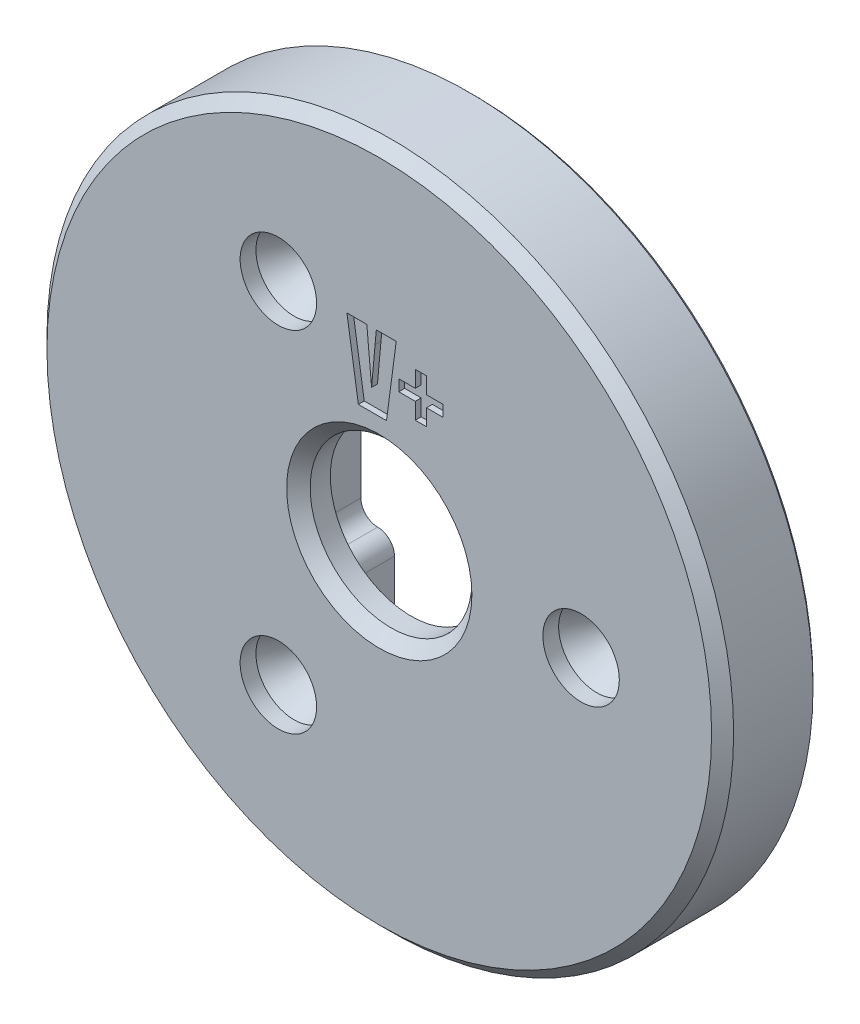
from build123d import *

# Parameters (mm, degrees)
SKETCH_3_R          = 23.35
EXTRUDE_3_DEPTH     = 6.4
SKETCH_2_R          = 21.8
CUT_EXTRUDE_1_DEPTH = 1.63
CUT_EXTRUDE_START   = 1.63
CUT_EXTRUDE_2_DEPTH = 2.6
SKETCH_5_R          = 1.35000002
SKETCH_5_R_2        = 1.35
CUT_EXTRUDE_3_DEPTH = 4.77
CUT_EXTRUDE_START_2 = 4.23
SKETCH_5_3_R        = 5.5
CUT_EXTRUDE_4_DEPTH = 2.17
CHAMFER_1_SIZE      = 0.75
CUT_EXTRUDE_START_3 = 6.4
SKETCH_6_R          = 2.6
CUT_EXTRUDE_5_DEPTH = 1
CHAMFER_2_SIZE      = 1.29
CHAMFER_2_SIZE_2    = 2.385
CHAMFER_3_SIZE      = 0.25
CHAMFER_4_SIZE      = 0.8
CUT_EXTRUDE_7_DEPTH = 0.4
CUT_EXTRUDE_8_DEPTH = 1.5


with BuildPart() as part:
    # 草图3 → 凸台-拉伸3 (new body)
    with BuildSketch(Plane.XY):
        with Locations((100.00000066, 100.00000066)):
            Circle(SKETCH_3_R)
    extrude(amount=EXTRUDE_3_DEPTH)

    # 草图2 → 切除-拉伸1 (cut)
    with BuildSketch(Plane.XY):
        with Locations((100.00000066, 100.00000066)):
            Circle(SKETCH_2_R)
    extrude(amount=CUT_EXTRUDE_1_DEPTH, mode=Mode.SUBTRACT)

    # 草图4 → 切除-拉伸2 (cut)
    with BuildSketch(Plane.XY.offset(CUT_EXTRUDE_START)):
        with BuildLine():
            Line((98.171, 114.173), (98.171, 115.57))
            ThreePointArc((98.171, 115.57), (98.282592316, 115.839407684), (98.552, 115.951))
            Line((98.552, 115.951), (102.87, 115.951))
            ThreePointArc((102.87, 115.951), (103.139407684, 115.839407684), (103.251, 115.57))
            Line((103.251, 115.57), (103.251, 114.808))
            ThreePointArc((103.251, 114.808), (103.362592316, 114.538592316), (103.632, 114.427))
            Line((103.632, 114.427), (109.728, 114.427))
            ThreePointArc((109.728, 114.427), (110.44642049, 114.12942049), (110.744, 113.411))
            Line((110.744, 113.411), (110.744, 110.363))
            ThreePointArc((110.744, 110.363), (110.892789755, 110.003789755), (111.252, 109.855))
            Line((111.252, 109.855), (115.951, 109.855))
            ThreePointArc((115.951, 109.855), (116.489815367, 109.631815367), (116.713, 109.093))
            Line((116.713, 109.093), (116.713, 104.521))
            ThreePointArc((116.713, 104.521), (117.01057951, 103.80257951), (117.729, 103.505))
            ThreePointArc((117.729, 103.505), (118.088210245, 103.356210245), (118.237, 102.997))
            Line((118.237, 102.997), (118.237, 102.362))
            ThreePointArc((118.237, 102.362), (118.162605122, 102.182394878), (117.983, 102.108))
            Line((117.983, 102.108), (116.586, 102.108))
            ThreePointArc((116.586, 102.108), (116.226789755, 102.256789755), (116.078, 102.616))
            ThreePointArc((116.078, 102.616), (115.892012806, 103.065012806), (115.443, 103.251))
            Line((115.443, 103.251), (106.426, 103.251))
            ThreePointArc((106.426, 103.251), (105.976987194, 103.065012806), (105.791, 102.616))
            Line((105.791, 102.616), (105.791, 95.377))
            ThreePointArc((105.791, 95.377), (105.939789755, 95.017789755), (106.299, 94.869))
            Line((106.299, 94.869), (115.57, 94.869))
            ThreePointArc((115.57, 94.869), (115.749605122, 94.794605122), (115.824, 94.615))
            Line((115.824, 94.615), (115.824, 92.202))
            ThreePointArc((115.824, 92.202), (115.638012806, 91.752987194), (115.189, 91.567))
            Line((115.189, 91.567), (115.062, 91.567))
            ThreePointArc((115.062, 91.567), (114.702789755, 91.418210245), (114.554, 91.059))
            Line((114.554, 91.059), (114.554, 89.662))
            ThreePointArc((114.554, 89.662), (114.405210245, 89.302789755), (114.046, 89.154))
            Line((114.046, 89.154), (111.887, 89.154))
            ThreePointArc((111.887, 89.154), (111.527789755, 89.005210245), (111.379, 88.646))
            Line((111.379, 88.646), (111.379, 87.884))
            ThreePointArc((111.379, 87.884), (111.230210245, 87.524789755), (110.871, 87.376))
            Line((110.871, 87.376), (109.855, 87.376))
            ThreePointArc((109.855, 87.376), (109.495789755, 87.227210245), (109.347, 86.868))
            Line((109.347, 86.868), (109.347, 85.344))
            ThreePointArc((109.347, 85.344), (109.161012806, 84.894987194), (108.712, 84.709))
            Line((108.712, 84.709), (107.188, 84.709))
            ThreePointArc((107.188, 84.709), (107.008394878, 84.634605122), (106.934, 84.455))
            ThreePointArc((106.934, 84.455), (106.896802561, 84.365197439), (106.807, 84.328))
            Line((106.807, 84.328), (103.759, 84.328))
            ThreePointArc((103.759, 84.328), (103.130382072, 84.067617928), (102.87, 83.439))
            ThreePointArc((102.87, 83.439), (102.758407684, 83.169592316), (102.489, 83.058))
            Line((102.489, 83.058), (96.901, 83.058))
            ThreePointArc((96.901, 83.058), (96.451987194, 83.243987194), (96.266, 83.693))
            Line((96.266, 83.693), (96.266, 94.869))
            ThreePointArc((96.266, 94.869), (95.931223051, 95.677223051), (95.123, 96.012))
            ThreePointArc((95.123, 96.012), (94.314776949, 96.346776949), (93.98, 97.155))
            Line((93.98, 97.155), (93.98, 103.632))
            ThreePointArc((93.98, 103.632), (94.351974388, 104.530025612), (95.25, 104.902))
            ThreePointArc((95.25, 104.902), (96.058223051, 105.236776949), (96.393, 106.045))
            Line((96.393, 106.045), (96.393, 113.665))
            ThreePointArc((96.393, 113.665), (96.541789755, 114.024210245), (96.901, 114.173))
            Line((96.901, 114.173), (98.171, 114.173))
        make_face()
    extrude(amount=CUT_EXTRUDE_2_DEPTH, mode=Mode.SUBTRACT)

    # 草图5 → 切除-拉伸3 (cut)
    with BuildSketch(Plane.XY.offset(CUT_EXTRUDE_START)):
        with Locations((113.72499988, 100.00000066)):
            Circle(SKETCH_5_R)
        with Locations((93.13749978, 111.8861999)):
            Circle(SKETCH_5_R_2)
        with Locations((93.13750232, 88.11380142)):
            Circle(SKETCH_5_R)
    extrude(amount=CUT_EXTRUDE_3_DEPTH, mode=Mode.SUBTRACT)

    # 草图5<3> → 切除-拉伸4 (cut)
    with BuildSketch(Plane.XY.offset(CUT_EXTRUDE_START_2)):
        with Locations((100.00000066, 100.00000066)):
            Circle(SKETCH_5_3_R)
    extrude(amount=CUT_EXTRUDE_4_DEPTH, mode=Mode.SUBTRACT)

    # 倒角1
    chamfer_1_edges = [part.edges().sort_by_distance(p)[0] for p in [
        (76.65000066, 100.00000066, 6.4),
    ]]
    chamfer(chamfer_1_edges, length=CHAMFER_1_SIZE)

    # 草图6 → 切除-拉伸5 (cut)
    with BuildSketch(Plane.XY.offset(CUT_EXTRUDE_START_3)):
        with Locations((93.13749978, 111.8861999)):
            Circle(SKETCH_6_R)
        with Locations((93.13750232, 88.11380142)):
            Circle(SKETCH_6_R)
        with Locations((113.72499988, 100.00000066)):
            Circle(SKETCH_6_R)
    extrude(amount=-CUT_EXTRUDE_5_DEPTH, mode=Mode.SUBTRACT)

    # 倒角2
    # the kernel refuses this chamfer: 2.385, 1.29 mm, written as the material it takes off along each edge
    with BuildSketch(Plane(origin=(113.72499988, 100.00000066, 5.4), x_dir=(1, 0, 0), z_dir=(0, 1, 0))) as chamfer_2_piece_1_section:
        Polygon((1.35000002 + CHAMFER_2_SIZE, 0), (1.35000002, CHAMFER_2_SIZE_2), (1.35000002, 0), align=None)
    chamfer_2_piece_1 = revolve(axis=Axis((113.72499988, 100.00000066, 5.4), (0, 0, -1)), mode=Mode.PRIVATE)
    chamfer_2_piece_1 = chamfer_2_piece_1 & Plane(origin=(113.72499988, 100.00000066, 4.141318071), x_dir=(1, 0, 0), z_dir=(0, 0, 1)) * Cylinder(2.6, 11, mode=Mode.PRIVATE)
    add(chamfer_2_piece_1, mode=Mode.SUBTRACT)
    with BuildSketch(Plane(origin=(93.13750232, 88.11380142, 5.4), x_dir=(1, 0, 0), z_dir=(0, 1, 0))) as chamfer_2_piece_2_section:
        Polygon((1.35000002 + CHAMFER_2_SIZE, 0), (1.35000002, CHAMFER_2_SIZE_2), (1.35000002, 0), align=None)
    chamfer_2_piece_2 = revolve(axis=Axis((93.13750232, 88.11380142, 5.4), (0, 0, -1)), mode=Mode.PRIVATE)
    chamfer_2_piece_2 = chamfer_2_piece_2 & Plane(origin=(93.13750232, 88.11380142, 4.141318071), x_dir=(1, 0, 0), z_dir=(0, 0, 1)) * Cylinder(2.6, 11, mode=Mode.PRIVATE)
    add(chamfer_2_piece_2, mode=Mode.SUBTRACT)
    with BuildSketch(Plane(origin=(93.13749978, 111.8861999, 5.4), x_dir=(1, 0, 0), z_dir=(0, 1, 0))) as chamfer_2_piece_3_section:
        Polygon((1.35 + CHAMFER_2_SIZE, 0), (1.35, CHAMFER_2_SIZE_2), (1.35, 0), align=None)
    chamfer_2_piece_3 = revolve(axis=Axis((93.13749978, 111.8861999, 5.4), (0, 0, -1)), mode=Mode.PRIVATE)
    chamfer_2_piece_3 = chamfer_2_piece_3 & Plane(origin=(93.13749978, 111.8861999, 4.14131809), x_dir=(1, 0, 0), z_dir=(0, 0, 1)) * Cylinder(2.6, 11, mode=Mode.PRIVATE)
    add(chamfer_2_piece_3, mode=Mode.SUBTRACT)

    # 倒角3
    chamfer_3_edges = [part.edges().sort_by_distance(p)[0] for p in [
        (76.65000066, 100.00000066, 0),
        (78.20000066, 100.00000066, 0),
    ]]
    chamfer(chamfer_3_edges, length=CHAMFER_3_SIZE)

    # 倒角4
    chamfer_4_edges = [part.edges().sort_by_distance(p)[0] for p in [
        (94.50000066, 100.00000066, 6.4),
    ]]
    chamfer(chamfer_4_edges, length=CHAMFER_4_SIZE)

    # 草图7 → 切除-拉伸7 (cut)
    with BuildSketch(Plane.XY.offset(CUT_EXTRUDE_START_3)):
        with BuildLine():
            Line((101.153292027, 112.351983356), (100.491527321, 107.351983356))
            Line((100.491527321, 107.351983356), (98.579762615, 107.351983356))
            Line((98.579762615, 107.351983356), (97.800350851, 112.351983356))
            Line((97.800350851, 112.351983356), (99.153292027, 112.351983356))
            add(Edge.make_bspline(
                [(99.153292027, 112.351983356), (99.168921879, 112.183478907), (99.199612846, 111.852601535), (99.244769811, 111.364867467), (99.287839178, 110.894880063), (99.32934088, 110.442074285), (99.36873281, 110.007013377), (99.406549784, 109.589133158), (99.442298553, 109.189001817), (99.465495493, 108.927964622), (99.476821439, 108.800512768)],
                knots=[0, 0, 0, 0, 1.138884633, 2.23632763, 3.296435453, 4.315101947, 5.296434007, 6.236325144, 7.138882761, 8, 8, 8, 8], degree=3))
            add(Edge.make_bspline(
                [(99.476821439, 108.800512768), (99.487820182, 108.924289993), (99.50949114, 109.168169772), (99.54197814, 109.527795956), (99.57177187, 109.875936959), (99.602376256, 110.211670122), (99.631747985, 110.535509401), (99.660256803, 110.847088908), (99.687810927, 111.146723094), (99.705975255, 111.342486994), (99.714872909, 111.438380415)],
                knots=[0, 0, 0, 0, 1.126017228, 2.218605494, 3.271989625, 4.292190047, 5.273432066, 6.218480867, 7.127336737, 8, 8, 8, 8], degree=3))
            Line((99.714872909, 111.438380415), (99.800350851, 112.351983356))
            Line((99.800350851, 112.351983356), (101.153292027, 112.351983356))
        make_face()
        Polygon((101.329762615, 110.234336298), (102.447409674, 110.234336298), (102.447409674, 111.351983356), (103.212115556, 111.351983356), (103.212115556, 110.234336298), (104.329762615, 110.234336298), (104.329762615, 109.469630415), (103.212115556, 109.469630415), (103.212115556, 108.351983356), (102.447409674, 108.351983356), (102.447409674, 109.469630415), (101.329762615, 109.469630415), align=None)
    extrude(amount=-CUT_EXTRUDE_7_DEPTH, mode=Mode.SUBTRACT)

    # 草图8 → 切除-拉伸8 (cut)
    with BuildSketch(Plane.XY.offset(CUT_EXTRUDE_START)):
        Polygon((82.169, 102.87), (83.058, 102.87), (83.439, 102.489), (83.439, 98.425), (83.82, 98.044), (86.868, 98.044), (87.122, 98.298), (87.122, 101.981), (87.376, 102.235), (91.313, 102.235), (91.567, 102.489), (91.567, 107.95), (91.186, 108.331), (88.592596753, 108.331), (87.840706234, 109.082890519), (85.376287582, 109.082890519), (85.217, 108.923602937), (85.217, 108.077), (84.836, 107.696), (83.185, 107.696), (82.169, 106.68), align=None)
    extrude(amount=CUT_EXTRUDE_8_DEPTH, mode=Mode.SUBTRACT)


solid = part.part
